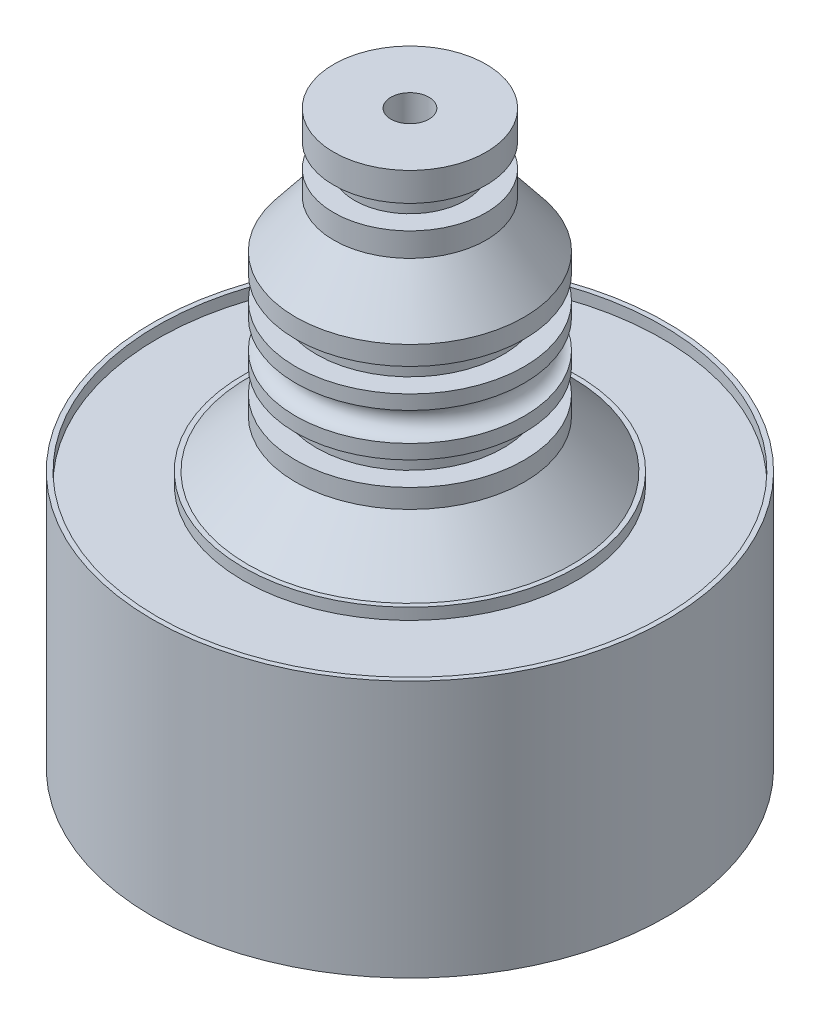
from build123d import *


with BuildPart() as part:
    # Эскиз1 → Повернуть1 (revolve)
    with BuildSketch(Plane.XY):
        with BuildLine():
            Line((2, 60), (2, 0))
            Line((2, 0), (25, 0))
            Line((25, 0), (27, 0))
            Line((27, 0), (27, 27))
            Line((27, 27), (26.5, 27))
            Line((26.5, 27), (26.5, 25.8))
            Line((26.5, 25.8), (17.5, 25.8))
            Line((17.5, 25.8), (17.5, 27))
            Line((17.5, 27), (17, 27))
            Line((17, 27), (12, 32))
            Line((12, 32), (12, 34))
            Line((12, 34), (9.8, 34))
            Line((9.8, 34), (9.8, 36.5))
            Line((9.8, 36.5), (12, 36.5))
            Line((12, 36.5), (12, 38))
            ThreePointArc((12, 38), (10.5, 39.5), (12, 41))
            Line((12, 41), (12, 42.5))
            Line((12, 42.5), (9.8, 42.5))
            Line((9.8, 42.5), (9.8, 45))
            Line((9.8, 45), (12, 45))
            Line((12, 45), (12, 47))
            Line((12, 47), (8, 52))
            Line((8, 52), (8, 54.5))
            Line((8, 54.5), (5.8, 54.5))
            Line((5.8, 54.5), (5.8, 57))
            Line((5.8, 57), (8, 57))
            Line((8, 57), (8, 60))
            Line((8, 60), (2, 60))
        make_face()
    revolve(axis=Axis((0, 0, 0), (0, 1, 0)))


solid = part.part
